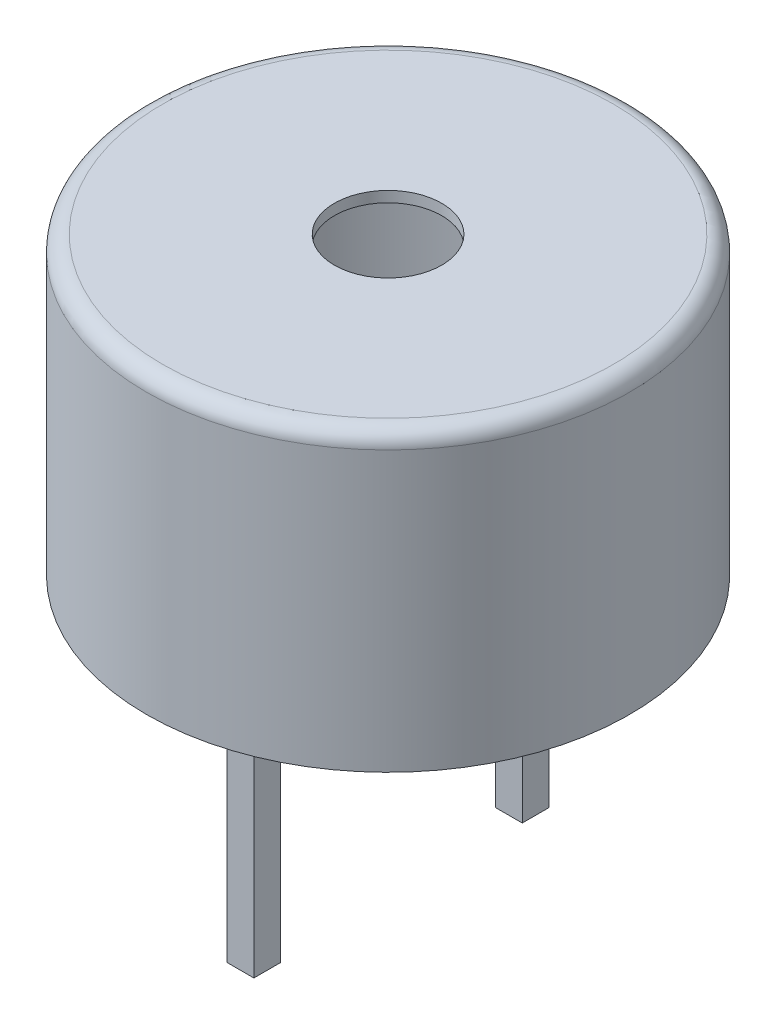
from build123d import *

# Parameters (mm, degrees)
CROQUIS1_R              = 4.5
SALIENTE_EXTRUIR1_DEPTH = 1
CROQUIS2_R              = 4.5
CROQUIS2_R_2            = 3.5
SALIENTE_EXTRUIR2_DEPTH = 4.5
CROQUIS3_R              = 2.296416316
SALIENTE_EXTRUIR3_DEPTH = 2
SALIENTE_EXTRUIR4_START = -0.2
CROQUIS4_R              = 4.5
CROQUIS4_R_2            = 1
SALIENTE_EXTRUIR4_DEPTH = 0.2
CROQUIS5_W              = 0.5
CROQUIS5_H              = 0.5
SALIENTE_EXTRUIR5_DEPTH = 5
REDONDEO1_R             = 0.3


with BuildPart() as part:
    # Croquis1 → Saliente-Extruir1 (new body)
    with BuildSketch(Plane(origin=(0, 0, 0), x_dir=(1, 0, 0), z_dir=(0, 1, 0))):
        Circle(CROQUIS1_R)
    extrude(amount=SALIENTE_EXTRUIR1_DEPTH)

    # Croquis2 → Saliente-Extruir2 (add)
    with BuildSketch(Plane(origin=(0, 1, 0), x_dir=(1, 0, 0), z_dir=(0, 1, 0))):
        Circle(CROQUIS2_R)
        Circle(CROQUIS2_R_2, mode=Mode.SUBTRACT)
    extrude(amount=SALIENTE_EXTRUIR2_DEPTH)

    # Croquis3 → Saliente-Extruir3 (add)
    with BuildSketch(Plane(origin=(0, 1, 0), x_dir=(1, 0, 0), z_dir=(0, 1, 0))):
        Circle(CROQUIS3_R)
    extrude(amount=SALIENTE_EXTRUIR3_DEPTH)

    # Croquis4 → Saliente-Extruir4 (add)
    with BuildSketch(Plane(origin=(0, 5.5, 0), x_dir=(1, 0, 0), z_dir=(0, 1, 0)).offset(SALIENTE_EXTRUIR4_START)):
        Circle(CROQUIS4_R)
        Circle(CROQUIS4_R_2, mode=Mode.SUBTRACT)
    extrude(amount=SALIENTE_EXTRUIR4_DEPTH)

    # Croquis5 → Saliente-Extruir5 (add)
    with BuildSketch(Plane.XZ):
        with Locations((0, -2.5)):
            Rectangle(CROQUIS5_W, CROQUIS5_H)
        with Locations((0, 2.5)):
            Rectangle(CROQUIS5_W, CROQUIS5_H)
    extrude(amount=SALIENTE_EXTRUIR5_DEPTH)

    # Redondeo1
    redondeo1_edges = [part.edges().sort_by_distance(p)[0] for p in [
        (-4.5, 5.5, 0),
    ]]
    fillet(redondeo1_edges, radius=REDONDEO1_R)


solid = part.part
